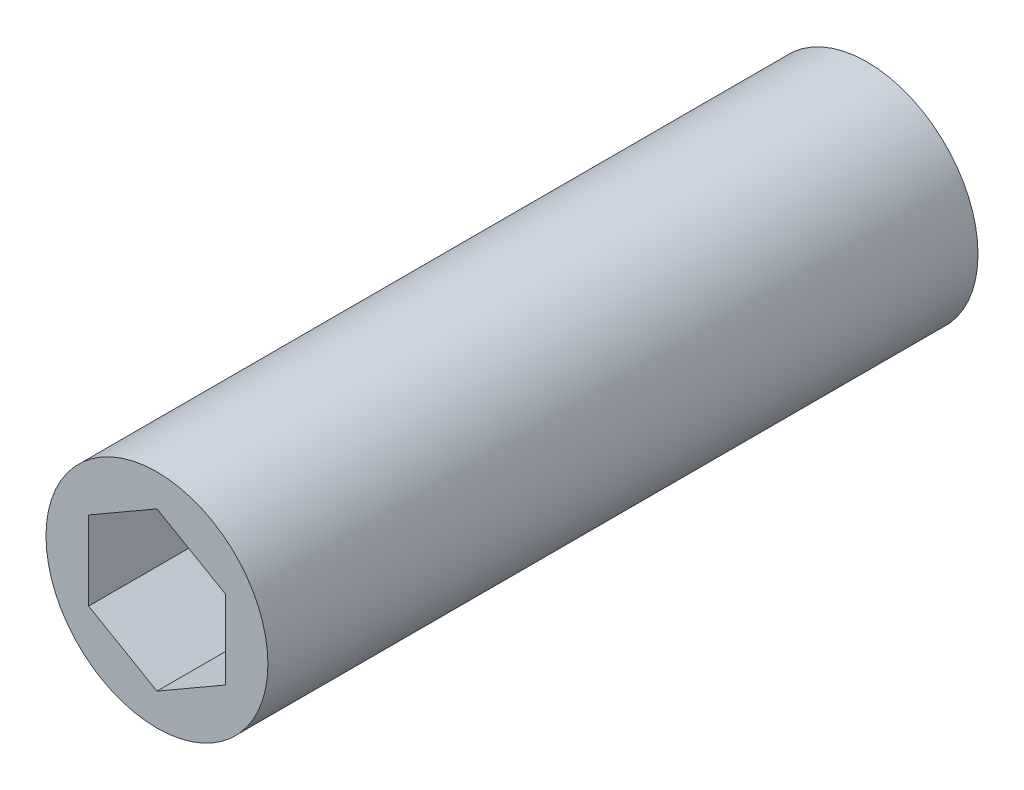
from build123d import *

# Parameters (mm, degrees)
SKETCH1_R           = 7.9375
BOSS_EXTRUDE1_DEPTH = 50.8


with BuildPart() as part:
    # Sketch1 → Boss-Extrude1 (new body)
    with BuildSketch(Plane.XY):
        Circle(SKETCH1_R)
        Polygon((0, 5.645908282), (-4.8895, 2.822954141), (-4.8895, -2.822954141), (0, -5.645908282), (4.8895, -2.822954141), (4.8895, 2.822954141), align=None, mode=Mode.SUBTRACT)
    extrude(amount=BOSS_EXTRUDE1_DEPTH)


solid = part.part
